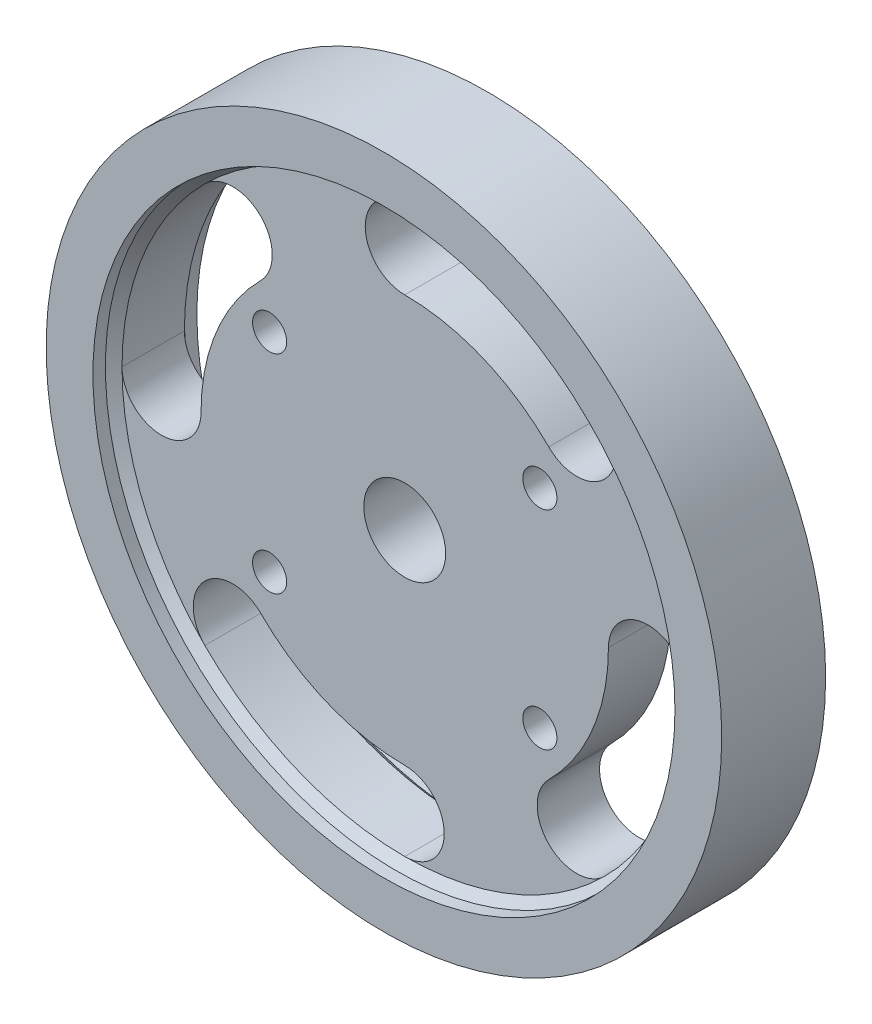
from build123d import *

# Parameters (mm, degrees)
SKETCH1_R               = 20.6375
BASE_DEPTH              = 6.35
SKETCH3_R               = 3.937
BOSS_EXTRUDE2_DEPTH     = 3.81
CUT_EXTRUDE2_DEPTH      = 30.868634259
CUT_EXTRUDE2_DEPTH_BACK = 30.868634259
SKETCH2_R               = 2.5
CUT_EXTRUDE3_DEPTH      = 30.868634259
SKETCH7_R               = 17.78
SKETCH7_R_2             = 12.446
CUT_EXTRUDE4_DEPTH      = 1.27
CHAMFER1_SIZE           = 0.508
CHAMFER2_SIZE           = 1.27
CHAMFER3_SIZE           = 0.254
CUT_EXTRUDE5_START      = -1.27
SKETCH8_R               = 17.78
CUT_EXTRUDE5_DEPTH      = 1.27
CHAMFER4_SIZE           = 0.508
SKETCH9_R               = 1.0414
CUT_EXTRUDE6_DEPTH      = 30.868634259
CUT_EXTRUDE7_DEPTH      = 0.381
CIRPATTERN1_COUNT       = 4


with BuildPart() as part:
    # Sketch1 → Base (new body)
    with BuildSketch(Plane.XY):
        Circle(SKETCH1_R)
    extrude(amount=BASE_DEPTH)

    # Sketch3 → Boss-Extrude2 (add)
    with BuildSketch(Plane(origin=(0, 0, 0), x_dir=(-1, 0, 0), z_dir=(0, 0, -1))):
        with Locations(Location((0, 0, 0), (0, 0, 180))):
            Circle(SKETCH3_R)
    extrude(amount=BOSS_EXTRUDE2_DEPTH)

    # Sketch2 → Cut-Extrude2 (cut, two sides: drawn at the far end of the back side and taken through both)
    with BuildSketch(Plane.XY.offset(-CUT_EXTRUDE2_DEPTH_BACK)):
        Circle(SKETCH2_R)
    extrude(amount=CUT_EXTRUDE2_DEPTH + CUT_EXTRUDE2_DEPTH_BACK, mode=Mode.SUBTRACT)

    # Sketch5 → Cut-Extrude3 (cut, through all)
    with BuildSketch(Plane.XY):
        with BuildLine():
            ThreePointArc((8.800650999, 8.800650999), (4.762877999, 11.498604662), (0, 12.446))
            ThreePointArc((0, 12.446), (-2.413, 14.859), (0, 17.272))
            ThreePointArc((0, 17.272), (6.609708244, 15.957247286), (12.213148325, 12.213148325))
            ThreePointArc((12.213148325, 12.213148325), (12.213148325, 8.800650999), (8.800650999, 8.800650999))
        make_face()
    cut_extrude3 = extrude(amount=CUT_EXTRUDE3_DEPTH, mode=Mode.SUBTRACT)

    # Sketch7 → Cut-Extrude4 (cut)
    with BuildSketch(Plane(origin=(0, 0, 0), x_dir=(-1, 0, 0), z_dir=(0, 0, -1))):
        Circle(SKETCH7_R)
        with Locations(Location((0, 0, 0), (0, 0, 90))):
            Circle(SKETCH7_R_2, mode=Mode.SUBTRACT)
    extrude(amount=-CUT_EXTRUDE4_DEPTH, mode=Mode.SUBTRACT)

    # Chamfer1
    chamfer1_edges = [part.edges().sort_by_distance(p)[0] for p in [
        (17.78, 0, 1.27),
    ]]
    chamfer(chamfer1_edges, length=CHAMFER1_SIZE - 0.0001)  # a hair under: the kernel refuses the full size

    # Chamfer2
    chamfer2_edges = [part.edges().sort_by_distance(p)[0] for p in [
        (-4.762877999, -11.498604662, 0),
    ]]
    chamfer(chamfer2_edges, length=CHAMFER2_SIZE - 0.0001)  # a hair under: the kernel refuses the full size

    # Chamfer3
    chamfer3_edges = [part.edges().sort_by_distance(p)[0] for p in [
        (-3.937, 0, -3.81),
    ]]
    chamfer(chamfer3_edges, length=CHAMFER3_SIZE)

    # Sketch8 → Cut-Extrude5 (cut)
    with BuildSketch(Plane.XY.offset(6.35).offset(CUT_EXTRUDE5_START)):
        with Locations(Location((0, 0, 0), (0, 0, 180))):
            Circle(SKETCH8_R)
    extrude(amount=CUT_EXTRUDE5_DEPTH, mode=Mode.SUBTRACT)

    # Chamfer4
    chamfer4_edges = [part.edges().sort_by_distance(p)[0] for p in [
        (17.78, 0, 5.08),
    ]]
    chamfer(chamfer4_edges, length=CHAMFER4_SIZE - 0.0001)  # a hair under: the kernel refuses the full size

    # Sketch9 → Cut-Extrude6 (cut, through all)
    with BuildSketch(Plane(origin=(0, 0, 0), x_dir=(-1, 0, 0), z_dir=(0, 0, -1))):
        with Locations(Location((-8.255, 6.35, 0), (0, 0, 97.477941582))):
            Circle(SKETCH9_R)
        with Locations(Location((8.255, 6.35, 0), (0, 0, 352.61512564))):
            Circle(SKETCH9_R)
        with Locations(Location((8.255, -6.35, 0), (0, 0, 7.384871496))):
            Circle(SKETCH9_R)
        with Locations(Location((-8.255, -6.35, 0), (0, 0, 262.522055553))):
            Circle(SKETCH9_R)
    extrude(amount=-CUT_EXTRUDE6_DEPTH, mode=Mode.SUBTRACT)

    # Sketch10 → Cut-Extrude7 (cut)
    with BuildSketch(Plane(origin=(0, 0, 0), x_dir=(-1, 0, 0), z_dir=(0, 0, -1))):
        with BuildLine():
            Line((-9.222915833, 5.091709417), (-9.736458912, 5.486742555))
            Line((-9.736458912, 5.486742555), (-10.229548299, 5.866042084))
            Line((-10.229548299, 5.866042084), (-8.293716633, 8.382623249))
            Line((-8.293716633, 8.382623249), (-7.800627246, 8.00332372))
            Line((-7.800627246, 8.00332372), (-7.287084167, 7.608290583))
            ThreePointArc((-7.287084167, 7.608290583), (-6.996709417, 5.382084167), (-9.222915833, 5.091709417))
        make_face()
        with BuildLine():
            Line((7.287084167, 7.608290583), (7.800627246, 8.00332372))
            Line((7.800627246, 8.00332372), (8.293716633, 8.382623249))
            Line((8.293716633, 8.382623249), (10.229548299, 5.866042084))
            Line((10.229548299, 5.866042084), (9.736458912, 5.486742555))
            Line((9.736458912, 5.486742555), (9.222915833, 5.091709417))
            ThreePointArc((9.222915833, 5.091709417), (6.996709417, 5.382084167), (7.287084167, 7.608290583))
        make_face()
        with BuildLine():
            Line((9.222915833, -5.091709417), (9.736458912, -5.486742555))
            Line((9.736458912, -5.486742555), (10.229548299, -5.866042084))
            Line((10.229548299, -5.866042084), (8.293716633, -8.382623249))
            Line((8.293716633, -8.382623249), (7.800627246, -8.00332372))
            Line((7.800627246, -8.00332372), (7.287084167, -7.608290583))
            ThreePointArc((7.287084167, -7.608290583), (6.996709417, -5.382084167), (9.222915833, -5.091709417))
        make_face()
        with BuildLine():
            Line((-7.287084167, -7.608290583), (-7.800627246, -8.00332372))
            Line((-7.800627246, -8.00332372), (-8.293716633, -8.382623249))
            Line((-8.293716633, -8.382623249), (-10.229548299, -5.866042084))
            Line((-10.229548299, -5.866042084), (-9.736458912, -5.486742555))
            Line((-9.736458912, -5.486742555), (-9.222915833, -5.091709417))
            ThreePointArc((-9.222915833, -5.091709417), (-6.996709417, -5.382084167), (-7.287084167, -7.608290583))
        make_face()
    extrude(amount=-CUT_EXTRUDE7_DEPTH, mode=Mode.SUBTRACT)

    # CirPattern1: Cut-Extrude3 ×4 about axis
    cirpattern1_axis = Axis((0, 0, 0), (0, 0, 1))
    for i in range(1, CIRPATTERN1_COUNT):
        add(cut_extrude3.rotate(cirpattern1_axis, i * 360 / CIRPATTERN1_COUNT), mode=Mode.SUBTRACT)


solid = part.part
